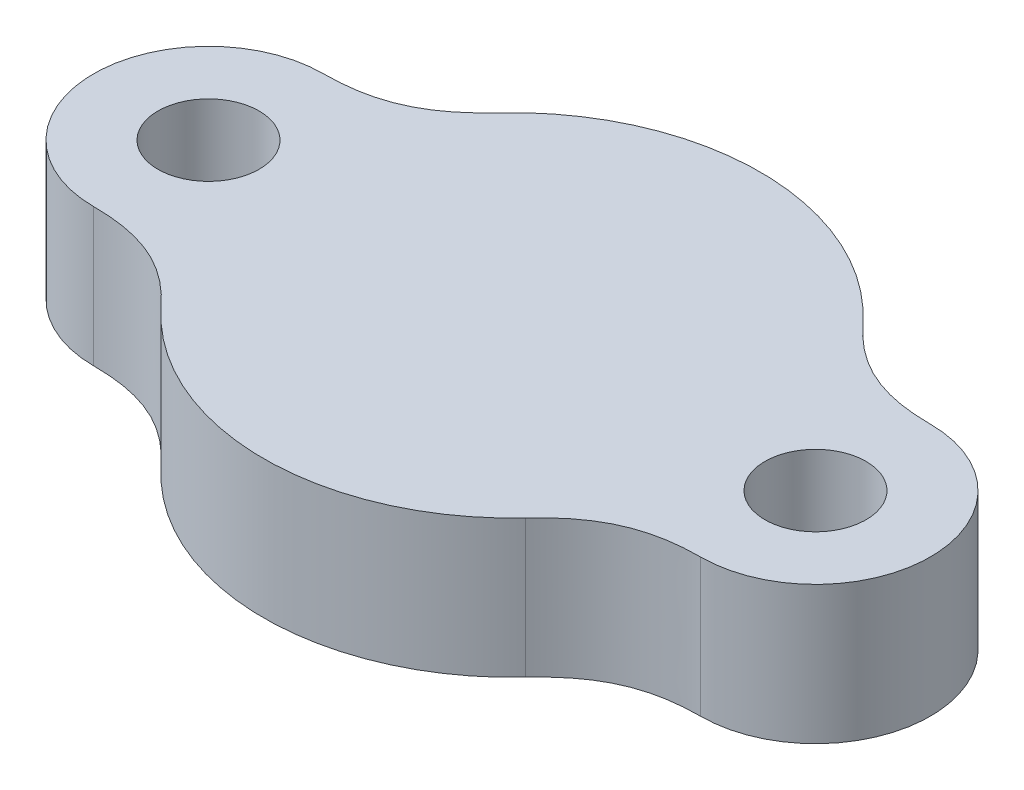
from build123d import *

# Parameters (mm, degrees)
BOSS_EXTRUDE1_START     = -8
BOSS_EXTRUDE1_OUTLINE_R = 1.1
BOSS_EXTRUDE1_DEPTH     = 8
SKETCH4_R               = 5.399616231
BOSS_EXTRUDE2_DEPTH     = 8
CUT_EXTRUDE1_DEPTH      = 12.881979778
CUT_EXTRUDE1_DEPTH_BACK = 12.881979778
SKETCH5_W               = 18.2
SKETCH5_H               = 5


# Read off the part's stored shape, not the designer's step: Boss-Extrude1
with BuildPart() as part:
    # Sketch1 → Revolve3 (revolve)
    with BuildSketch(Plane.XY):
        with BuildLine():
            Line((-5.399616231, -5.3975), (0, -5.3975))
            Line((0, -5.3975), (0, 2.6025))
            Line((0, 2.6025), (-3.988533565, 2.6025))
            ThreePointArc((-3.988533565, 2.6025), (-4.472061932, 1.637702149), (-4.725960888, 0.58881231))
            add(Edge.make_bspline(
                [(-4.725960888, 0.58881231), (-5.528679385, 0.558813228), (-5.399616231, 0.190451496), (-5.399616231, -0.666596714)],
                knots=[0, 0, 0, 0, 1, 1, 1, 1], degree=3))
            Line((-5.399616231, -0.666596714), (-5.399616231, -5.3975))
        make_face()
    revolve(axis=Axis((0, 8.574910523, 0), (0, -1, 0)))



with BuildPart() as body_2:
    # Boss-Extrude1 outline → Boss-Extrude1 (new body)
    # profile 1 of 2: a face of its own
    with BuildSketch(Plane.XZ.offset(5.3975).offset(BOSS_EXTRUDE1_START)):
        with BuildLine():
            add(Edge.make_bspline(
                [(6.6, -2.5), (5.362311666, -2.5), (4.636385799, -2.941104214), (3.959842535, -3.670899419)],
                knots=[0, 0, 0, 0, 1, 1, 1, 1], degree=3))
            ThreePointArc((6.6, -2.5), (9.1, 0), (6.6, 2.5))
            add(Edge.make_bspline(
                [(6.6, 2.5), (5.362311666, 2.5), (4.636385799, 2.941104214), (3.959842535, 3.670899419)],
                knots=[0, 0, 0, 0, 1, 1, 1, 1], degree=3))
            ThreePointArc((3.959842535, 3.670899419), (5.399616231, 0), (3.959842535, -3.670899419))
        make_face()
        with Locations((6.6, 0)):
            Circle(BOSS_EXTRUDE1_OUTLINE_R, mode=Mode.SUBTRACT)
    # profile 2 of 2: a face of its own
    with BuildSketch(Plane.XZ.offset(5.3975).offset(BOSS_EXTRUDE1_START)):
        with BuildLine():
            ThreePointArc((-6.6, 2.5), (-9.1, 0), (-6.6, -2.5))
            add(Edge.make_bspline(
                [(-6.6, -2.5), (-5.362311666, -2.5), (-4.636385799, -2.941104214), (-3.959842535, -3.670899419)],
                knots=[0, 0, 0, 0, 1, 1, 1, 1], degree=3))
            ThreePointArc((-3.959842535, -3.670899419), (-5.399616231, 0), (-3.959842535, 3.670899419))
            add(Edge.make_bspline(
                [(-6.6, 2.5), (-5.362311666, 2.5), (-4.636385799, 2.941104214), (-3.959842535, 3.670899419)],
                knots=[0, 0, 0, 0, 1, 1, 1, 1], degree=3))
        make_face()
        with Locations((-6.6, 0)):
            Circle(BOSS_EXTRUDE1_OUTLINE_R, mode=Mode.SUBTRACT)
    extrude(amount=BOSS_EXTRUDE1_DEPTH)


with BuildPart() as part_1:
    add(part.part)

    add(body_2.part)  # Boss-Extrude2 merges body 2
    # Sketch4 → Boss-Extrude2 (add)
    with BuildSketch(Plane.XZ.offset(5.3975)):
        Circle(SKETCH4_R)
    extrude(amount=-BOSS_EXTRUDE2_DEPTH)

    # Sketch5 → Cut-Extrude1 (cut, two sides: drawn at the far end of the back side and taken through both)
    with BuildSketch(Plane.XY.offset(-CUT_EXTRUDE1_DEPTH_BACK)):
        with Locations((0, 0.1025)):
            Rectangle(SKETCH5_W, SKETCH5_H)
    extrude(amount=CUT_EXTRUDE1_DEPTH + CUT_EXTRUDE1_DEPTH_BACK, mode=Mode.SUBTRACT)


solid = part_1.part
